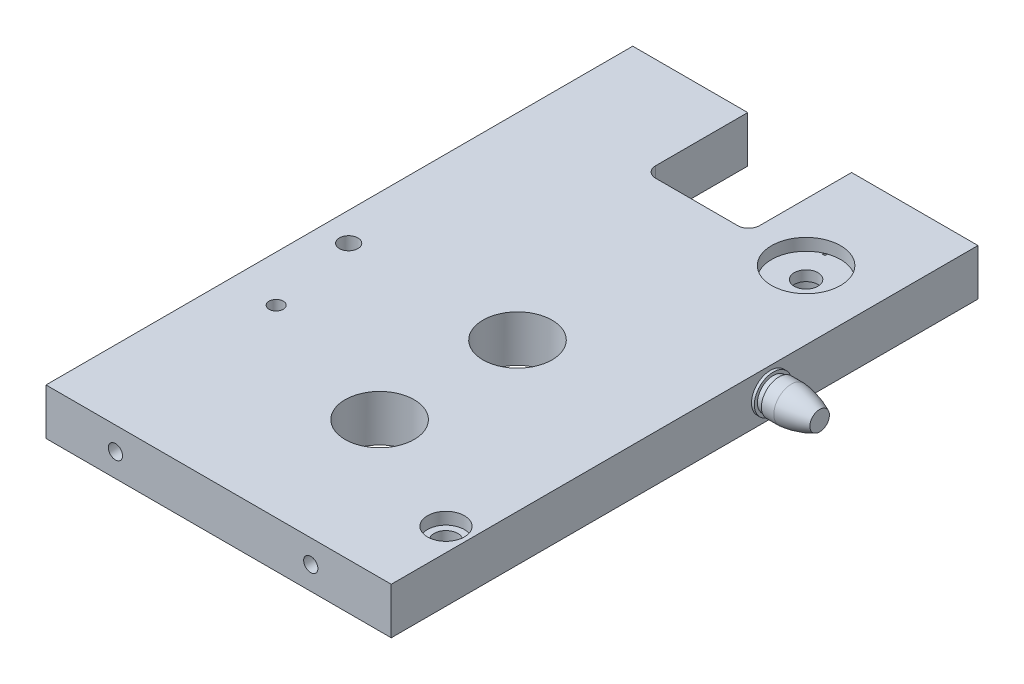
from build123d import *

# Parameters (mm, degrees)
SKETCH1_W           = 95.25
SKETCH1_H           = 12.8
BOSS_EXTRUDE1_DEPTH = 161.88
SKETCH1_3_R         = 3.1
CUT_EXTRUDE1_DEPTH  = 20.2
SKETCH1_4_R         = 2.395
CUT_EXTRUDE2_DEPTH  = 21.5
CUT_EXTRUDE3_REACH  = 369.677
SKETCH2_R           = 9.525
CUT_EXTRUDE4_REACH  = 369.677
SKETCH3_R           = 3.265
SKETCH3_R_2         = 1.96
SKETCH3_R_3         = 2.56
SKETCH4_R           = 9.525
SKETCH4_R_2         = 5.09
CUT_EXTRUDE5_DEPTH  = 3.32
SKETCH5_R           = 5.31
CUT_EXTRUDE6_DEPTH  = 6.65
SKETCH6_R           = 1.965
CUT_EXTRUDE7_DEPTH  = 17.25
SKETCH7_R           = 1.97
CUT_EXTRUDE8_DEPTH  = 15.87


with BuildPart() as part:
    # Sketch1 → Boss-Extrude1 (new body)
    with BuildSketch(Plane.XY):
        with Locations((-282.25, -616.5)):
            Rectangle(SKETCH1_W, SKETCH1_H)
    extrude(amount=BOSS_EXTRUDE1_DEPTH)

    # Sketch1<3> → Cut-Extrude1 (cut)
    with BuildSketch(Plane.XY):
        with Locations((-257, -616.5)):
            Circle(SKETCH1_3_R)
        with Locations((-307.5, -616.5)):
            Circle(SKETCH1_3_R)
    extrude(amount=CUT_EXTRUDE1_DEPTH, mode=Mode.SUBTRACT)

    # Sketch1<4> → Cut-Extrude2 (cut)
    with BuildSketch(Plane.XY):
        with Locations((-244.2, -616.5)):
            Circle(SKETCH1_4_R)
        with Locations((-320.5, -616.5)):
            Circle(SKETCH1_4_R)
    extrude(amount=CUT_EXTRUDE2_DEPTH, mode=Mode.SUBTRACT)

    # Sketch2 → Cut-Extrude3 (cut, up to next)
    with BuildSketch(Plane(origin=(0, -610.1, 0), x_dir=(1, 0, 0), z_dir=(0, 1, 0)), mode=Mode.PRIVATE) as cut_extrude3_sk1:
        with Locations((-275.57, -124.135)):
            Circle(SKETCH2_R)
    cut_extrude3_tool1 = extrude(cut_extrude3_sk1.sketch, amount=-CUT_EXTRUDE3_REACH, mode=Mode.PRIVATE) & part.part
    # Sketch2 → Cut-Extrude3 (cut, up to next)
    with BuildSketch(Plane(origin=(0, -610.1, 0), x_dir=(1, 0, 0), z_dir=(0, 1, 0)), mode=Mode.PRIVATE) as cut_extrude3_sk2:
        with Locations((-275.57, -86.105)):
            Circle(SKETCH2_R)
    cut_extrude3_tool2 = extrude(cut_extrude3_sk2.sketch, amount=-CUT_EXTRUDE3_REACH, mode=Mode.PRIVATE) & part.part
    # Sketch2 → Cut-Extrude3 (cut, up to next)
    with BuildSketch(Plane(origin=(0, -610.1, 0), x_dir=(1, 0, 0), z_dir=(0, 1, 0)), mode=Mode.PRIVATE) as cut_extrude3_sk3:
        with BuildLine():
            Line((-269.505, 0), (-298.155, 0))
            Line((-298.155, 0), (-298.155, -25.4))
            ThreePointArc((-298.155, -25.4), (-297.276320344, -27.521320344), (-295.155, -28.4))
            Line((-295.155, -28.4), (-272.505, -28.4))
            ThreePointArc((-272.505, -28.4), (-270.383679656, -27.521320344), (-269.505, -25.4))
            Line((-269.505, -25.4), (-269.505, 0))
        make_face()
    cut_extrude3_tool3 = extrude(cut_extrude3_sk3.sketch, amount=-CUT_EXTRUDE3_REACH, mode=Mode.PRIVATE) & part.part
    add(cut_extrude3_tool1.solids().sort_by_distance((-275.57, -610.1, 124.135))[0], mode=Mode.SUBTRACT)
    add(cut_extrude3_tool2.solids().sort_by_distance((-275.57, -610.1, 86.105))[0], mode=Mode.SUBTRACT)
    add(cut_extrude3_tool3.solids().sort_by_distance((-283.83, -610.1, 14.135461))[0], mode=Mode.SUBTRACT)

    # Sketch3 → Cut-Extrude4 (cut, up to next)
    with BuildSketch(Plane(origin=(0, -610.1, 0), x_dir=(-1, 0, 0), z_dir=(0, 1, 0)), mode=Mode.PRIVATE) as cut_extrude4_sk1:
        with Locations((240.925, 140.49)):
            Circle(SKETCH3_R)
    cut_extrude4_tool1 = extrude(cut_extrude4_sk1.sketch, amount=-CUT_EXTRUDE4_REACH, mode=Mode.PRIVATE) & part.part
    # Sketch3 → Cut-Extrude4 (cut, up to next)
    with BuildSketch(Plane(origin=(0, -610.1, 0), x_dir=(-1, 0, 0), z_dir=(0, 1, 0)), mode=Mode.PRIVATE) as cut_extrude4_sk2:
        with Locations((253.55, 28.505)):
            Circle(SKETCH3_R)
    cut_extrude4_tool2 = extrude(cut_extrude4_sk2.sketch, amount=-CUT_EXTRUDE4_REACH, mode=Mode.PRIVATE) & part.part
    # Sketch3 → Cut-Extrude4 (cut, up to next)
    with BuildSketch(Plane(origin=(0, -610.1, 0), x_dir=(-1, 0, 0), z_dir=(0, 1, 0)), mode=Mode.PRIVATE) as cut_extrude4_sk3:
        with Locations((317.175, 111.08)):
            Circle(SKETCH3_R_2)
    cut_extrude4_tool3 = extrude(cut_extrude4_sk3.sketch, amount=-CUT_EXTRUDE4_REACH, mode=Mode.PRIVATE) & part.part
    # Sketch3 → Cut-Extrude4 (cut, up to next)
    with BuildSketch(Plane(origin=(0, -610.1, 0), x_dir=(-1, 0, 0), z_dir=(0, 1, 0)), mode=Mode.PRIVATE) as cut_extrude4_sk4:
        with Locations((321.975, 86.28)):
            Circle(SKETCH3_R_3)
    cut_extrude4_tool4 = extrude(cut_extrude4_sk4.sketch, amount=-CUT_EXTRUDE4_REACH, mode=Mode.PRIVATE) & part.part
    add(cut_extrude4_tool1.solids().sort_by_distance((-240.925, -610.1, 140.49))[0], mode=Mode.SUBTRACT)
    add(cut_extrude4_tool2.solids().sort_by_distance((-253.55, -610.1, 28.505))[0], mode=Mode.SUBTRACT)
    add(cut_extrude4_tool3.solids().sort_by_distance((-317.175, -610.1, 111.08))[0], mode=Mode.SUBTRACT)
    add(cut_extrude4_tool4.solids().sort_by_distance((-321.975, -610.1, 86.28))[0], mode=Mode.SUBTRACT)

    # Sketch4 → Cut-Extrude5 (cut)
    with BuildSketch(Plane(origin=(0, -610.1, 0), x_dir=(-1, 0, 0), z_dir=(0, 1, 0))):
        with Locations((253.55, 28.505)):
            Circle(SKETCH4_R)
        with Locations((240.925, 140.49)):
            Circle(SKETCH4_R_2)
    extrude(amount=-CUT_EXTRUDE5_DEPTH, mode=Mode.SUBTRACT)

    # Sketch5 → Cut-Extrude6 (cut)
    with BuildSketch(Plane.XZ.offset(622.9)):
        with Locations((-240.925, 140.49)):
            Circle(SKETCH5_R)
        with Locations((-253.55, 28.505)):
            Circle(SKETCH5_R)
    extrude(amount=-CUT_EXTRUDE6_DEPTH, mode=Mode.SUBTRACT)

    # Sketch6 → Cut-Extrude7 (cut)
    with BuildSketch(Plane.XY.offset(161.88)):
        with Locations((-310.715, -616.48)):
            Circle(SKETCH6_R)
        with Locations((-256.825, -616.48)):
            Circle(SKETCH6_R)
    extrude(amount=-CUT_EXTRUDE7_DEPTH, mode=Mode.SUBTRACT)

    # Sketch7 → Cut-Extrude8 (cut)
    with BuildSketch(Plane.ZY.offset(329.875)):
        with Locations((142.28, -616.5)):
            Circle(SKETCH7_R)
    extrude(amount=-CUT_EXTRUDE8_DEPTH, mode=Mode.SUBTRACT)

    # Sketch8 → Revolve1 (revolve)
    with BuildSketch(Plane(origin=(0, -616.5, 0), x_dir=(-1, 0, 0), z_dir=(0, 1, 0))):
        with BuildLine():
            Line((234.625, 57.29), (221.025, 57.29))
            Line((221.025, 57.29), (221.025, 54.59))
            ThreePointArc((221.025, 54.59), (224.841543887, 53.18542762), (228.845807042, 52.475))
            Line((228.845807042, 52.475), (232.275807042, 52.475))
            Line((232.275807042, 52.475), (232.295, 52.925))
            Line((232.295, 52.925), (233.835, 52.925))
            Line((233.835, 52.925), (233.835, 52.09))
            Line((233.835, 52.09), (234.625, 52.09))
            Line((234.625, 52.09), (234.625, 57.29))
        make_face()
    revolve(axis=Axis((-234.625, -616.5, 57.29), (-1, 0, 0)))


solid = part.part
